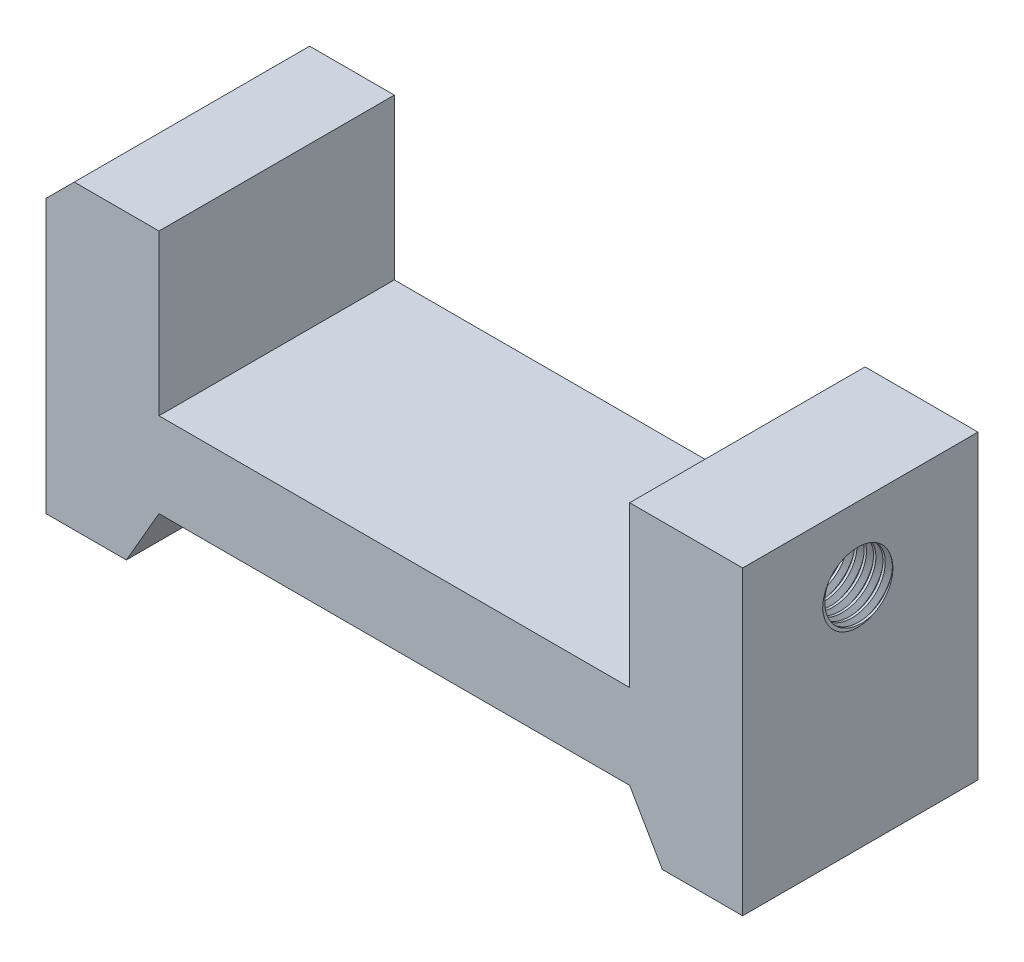
from build123d import *

# Parameters (mm, degrees)
BOSS_EXTRUDE1_DEPTH        = 25
CHAMFER1_SIZE              = 3
F_8_0MM_DOWEL_HOLE2_REACH  = 81.937
F_8_0MM_DOWEL_HOLE2_BORE_R = 4
THREAD1_PITCH              = 1
THREAD1_FROM               = 1
THREAD1_TO                 = 13


with BuildPart() as part:
    # Sketch1 → Boss-Extrude1 (new body)
    with BuildSketch(Plane.XY):
        Polygon((-25, 0), (-25, 17), (-37, 17), (-37, -15), (-28.464101615, -15), (-25, -9), (25, -9), (28.464101615, -15), (37, -15), (37, 17), (25, 17), (25, 0), align=None)
    extrude(amount=-BOSS_EXTRUDE1_DEPTH)

    # Chamfer1
    chamfer1_edges = [part.edges().sort_by_distance(p)[0] for p in [
        (-37, 17, -12.5),
    ]]
    chamfer(chamfer1_edges, length=CHAMFER1_SIZE)

    # Ø8.0mm Dowel Hole2 bore → Ø8.0mm Dowel Hole2 (cut, up to next)
    with BuildSketch(Plane(origin=(37, 0, 0), x_dir=(0, 0, -1), z_dir=(1, 0, 0)), mode=Mode.PRIVATE) as f_8_0mm_dowel_hole2_sk1:
        with Locations((12.5, 9)):
            Circle(F_8_0MM_DOWEL_HOLE2_BORE_R)
    f_8_0mm_dowel_hole2_tool1 = extrude(f_8_0mm_dowel_hole2_sk1.sketch, amount=-F_8_0MM_DOWEL_HOLE2_REACH, mode=Mode.PRIVATE) & part.part
    add(f_8_0mm_dowel_hole2_tool1.solids().sort_by_distance((37, 9, -12.5))[0], mode=Mode.SUBTRACT)

    # Thread1: arcs per turn and ends read off the stored shape
    # Thread1: the profile of Thread Profile1 profile screwed along a right-hand helix through 14 turns, 8 arcs to a turn; built about Z, then put on its axis
    thread1_z = Axis((0, 0, 0), (0, 0, 1))
    thread1_corners = [(4.0003, 0, -0.000173205), (4.0003, 0, 0.875173202), (3.458734125, 0, 0.562499999), (3.458734125, 0, 0.312499999)]
    with BuildLine(mode=Mode.PRIVATE) as thread1_profile:
        Line(thread1_corners[0], thread1_corners[1])
        Line(thread1_corners[1], thread1_corners[2])
        Line(thread1_corners[2], thread1_corners[3])
        Line(thread1_corners[3], thread1_corners[0])
    thread1_cap = Face(thread1_profile.wire())
    thread1_turn_angles = [0, 22.5, 45, 67.5, 90, 112.5, 135, 157.5, 180, 202.5, 225, 247.5, 270, 292.5, 315, 337.5, 360]
    thread1_turn_weights = [1, 0.9238795325112867, 1, 0.9238795325112867, 1, 0.9238795325112867, 1, 0.9238795325112867, 1, 0.9238795325112867, 1, 0.9238795325112867, 1, 0.9238795325112867, 1, 0.9238795325112867, 1]
    thread1_turn_rails = [Edge.make_bspline([Vector(p[0], p[1], 0).rotate(thread1_z, thread1_turn_angles[k]) / thread1_turn_weights[k] + Vector(0, 0, p[2] + THREAD1_PITCH * thread1_turn_angles[k] / 360) for k in range(17)], [0, 0, 0, 1, 1, 2, 2, 3, 3, 4, 4, 5, 5, 6, 6, 7, 7, 8, 8, 8], 2, thread1_turn_weights) for p in thread1_corners]
    thread1_turn_sides = [Face.make_surface_from_curves(thread1_turn_rails[p[0]], thread1_turn_rails[p[1]]) for p in [(0, 1), (1, 2), (2, 3), (3, 0)]]
    thread1 = Plane(origin=(38, 9, -12.5), x_dir=(0, 0, 1), z_dir=(-1, 0, 0)) * split(split(Solid(Shell([*[p.moved(Location((0, 0, THREAD1_PITCH * i))) for i in range(14) for p in thread1_turn_sides], thread1_cap, thread1_cap.rotate(thread1_z, 5040).moved(Location((0, 0, THREAD1_PITCH * 5040 / 360)))])), bisect_by=Plane.XY.offset(THREAD1_FROM), keep=Keep.TOP, mode=Mode.PRIVATE), bisect_by=Plane.XY.offset(THREAD1_TO), keep=Keep.BOTTOM, mode=Mode.PRIVATE)
    add(thread1)


solid = part.part
